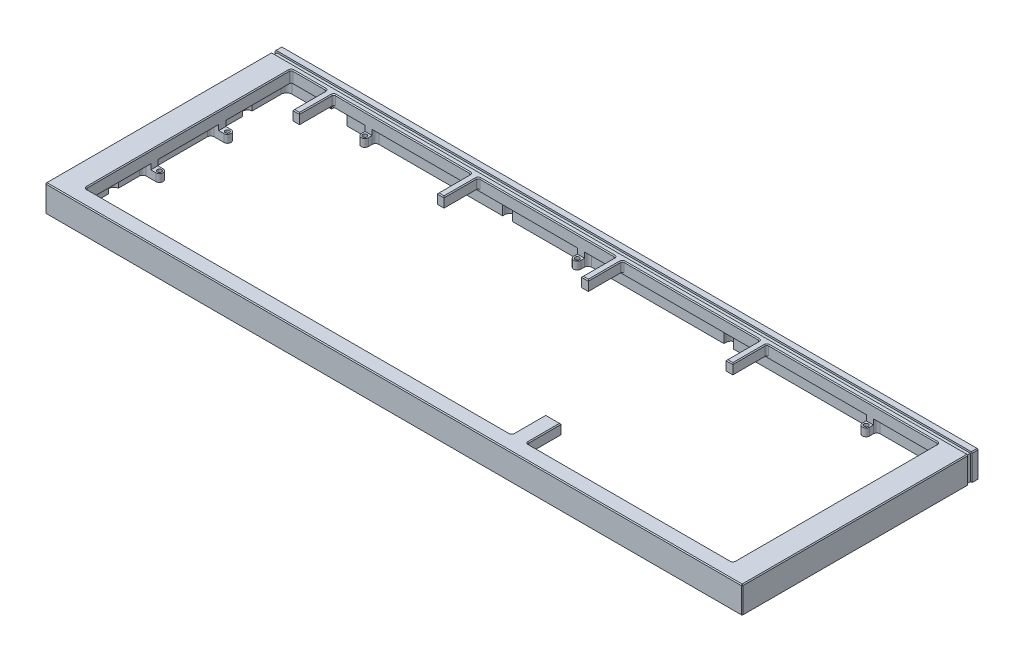
from build123d import *

# Parameters (mm, degrees)
SKETCH1_W                 = 390.74
SKETCH1_H                 = 132.7
SKETCH1_W_2               = 362.9
SKETCH1_H_2               = 115.3
MAIN_BODY_DEPTH           = 14.8
SKETCH2_W                 = 386.74
SKETCH2_H                 = 128.7
ALIGNMENT_GUIDE_DEPTH     = 1
SKETCH3_W                 = 8.7
SKETCH3_H                 = 19.1
SKETCH3_W_2               = 3.8
BLOCKERS_DEPTH            = 5.5
FILLET5_R                 = 1
SKETCH4_W                 = 371.8
SKETCH4_H                 = 119.1
PCB_CUTOUT_DEPTH          = 7.3
FILLET4_R                 = 3
PLATETABS_DEPTH           = 7.3
USB_CUTOUT_REACH          = 414.924
SKETCH9_W                 = 12
SKETCH9_H                 = 3.2
SKETCH11_W                = 15
SKETCH11_H                = 7.3
PCB_CLEARANCE_DEPTH       = 3.9
FILLET7_R                 = 2.5
CHAMFER1_SIZE             = 0.5
CHAMFER2_SIZE             = 0.1
SKETCH27_W                = 390.74
SKETCH27_H                = 2.5
CUT_EXTRUDE11_DEPTH       = 1
SKETCH28_W                = 1
SKETCH28_H                = 2.5
CUT_EXTRUDE12_DEPTH       = 413.889183196
M2X0_4_TAPPED_HOLE1_D     = 1.6
M2X0_4_TAPPED_HOLE1_DEPTH = 4
M2X0_4_TAPPED_HOLE1_TIP   = 0.480688495
FILLET8_R                 = 0.1
SKETCH32_R                = 2
SKETCH32_W                = 4
SKETCH32_H                = 4
SKETCH32_W_2              = 7.33
SKETCH32_H_2              = 4.8
BOSS_EXTRUDE1_DEPTH       = 4.3
SKETCH33_W                = 4.45
SKETCH33_H                = 4
SKETCH33_W_2              = 4
SKETCH33_H_2              = 1.9
BOSS_EXTRUDE2_DEPTH       = 3
FILLET9_R                 = 1.9
M2_CLEARANCE_HOLE1_D      = 2.4


with BuildPart() as part:
    # Sketch1 → Main Body (new body)
    with BuildSketch(Plane(origin=(0, 0, 0), x_dir=(1, 0, 0), z_dir=(0, 1, 0))):
        with Locations((195.37, 66.35)):
            Rectangle(SKETCH1_W, SKETCH1_H)
        with Locations((195.37, 66.35)):
            Rectangle(SKETCH1_W_2, SKETCH1_H_2, mode=Mode.SUBTRACT)
    extrude(amount=MAIN_BODY_DEPTH)

    # Sketch2 → Alignment Guide (cut)
    with BuildSketch(Plane.XZ):
        with Locations((195.37, -66.35)):
            Rectangle(SKETCH2_W, SKETCH2_H)
    extrude(amount=-ALIGNMENT_GUIDE_DEPTH, mode=Mode.SUBTRACT)

    # Sketch3 → Blockers (add)
    with BuildSketch(Plane(origin=(0, 14.8, 0), x_dir=(1, 0, 0), z_dir=(0, 1, 0))):
        with Locations((257.17, 18.25)):
            Rectangle(SKETCH3_W, SKETCH3_H)
        with Locations((35.82, 114.45)):
            Rectangle(SKETCH3_W_2, SKETCH3_H)
        with Locations((116.82, 114.45)):
            Rectangle(SKETCH3_W_2, SKETCH3_H)
        with Locations((197.72, 114.45)):
            Rectangle(SKETCH3_W_2, SKETCH3_H)
        with Locations((278.72, 114.45)):
            Rectangle(SKETCH3_W_2, SKETCH3_H)
    extrude(amount=-BLOCKERS_DEPTH)

    # Fillet5
    fillet5_edges = [part.edges().sort_by_distance(p)[0] for p in [
        (13.92, 7.9, -124),
        (13.92, 7.9, -8.7),
        (376.82, 7.9, -8.7),
        (376.82, 7.9, -124),
        (252.82, 12.05, -8.7),
        (261.52, 12.05, -8.7),
        (33.92, 12.05, -124),
        (37.72, 12.05, -124),
        (114.92, 12.05, -124),
        (118.72, 12.05, -124),
        (195.82, 12.05, -124),
        (199.62, 12.05, -124),
        (276.82, 12.05, -124),
        (280.62, 12.05, -124),
    ]]
    fillet(fillet5_edges, radius=FILLET5_R)

    # Sketch4 → PCB Cutout (cut)
    with BuildSketch(Plane.XZ.offset(-1)):
        with Locations((195.37, -66.35)):
            Rectangle(SKETCH4_W, SKETCH4_H)
    extrude(amount=-PCB_CUTOUT_DEPTH, mode=Mode.SUBTRACT)

    # Fillet4
    fillet4_edges = [part.edges().sort_by_distance(p)[0] for p in [
        (381.27, 4.65, -6.8),
        (381.27, 4.65, -125.9),
        (9.47, 4.65, -125.9),
        (9.47, 4.65, -6.8),
        (2, 0.5, -2),
        (388.74, 0.5, -2),
        (388.74, 0.5, -130.7),
        (2, 0.5, -130.7),
    ]]
    fillet(fillet4_edges, radius=FILLET4_R)

    # Sketch6 → PlateTabs (cut)
    with BuildSketch(Plane.XZ.offset(-1)):
        with BuildLine():
            ThreePointArc((381.27, -106.59271763), (383.084013406, -105.722498331), (383.82, -103.85))
            ThreePointArc((383.82, -103.85), (383.084013406, -101.977501669), (381.27, -101.10728237))
            Line((381.27, -101.10728237), (381.27, -106.59271763))
        make_face()
        with BuildLine():
            Line((381.27, -106.59271763), (381.27, -101.10728237))
            ThreePointArc((381.27, -101.10728237), (378.32, -103.85), (381.27, -106.59271763))
        make_face()
        with BuildLine():
            ThreePointArc((381.27, -26.10728237), (378.32, -28.85), (381.27, -31.59271763))
            Line((381.27, -31.59271763), (381.27, -26.10728237))
        make_face()
        with BuildLine():
            Line((381.27, -26.10728237), (381.27, -31.59271763))
            ThreePointArc((381.27, -31.59271763), (383.084013406, -30.722498331), (383.82, -28.85))
            ThreePointArc((383.82, -28.85), (383.084013406, -26.977501669), (381.27, -26.10728237))
        make_face()
        with BuildLine():
            Line((254.62, -6.8), (255.482541391, -6.8))
            ThreePointArc((255.482541391, -6.8), (254.844825632, -5.889033706), (254.62, -4.8))
            Line((254.62, -4.8), (254.62, -6.8))
        make_face()
        with BuildLine():
            Line((255.482541391, -6.8), (259.257458609, -6.8))
            ThreePointArc((259.257458609, -6.8), (259.895174368, -5.889033706), (260.12, -4.8))
            Line((260.12, -4.8), (254.62, -4.8))
            ThreePointArc((254.62, -4.8), (254.844825632, -5.889033706), (255.482541391, -6.8))
        make_face()
        with BuildLine():
            Line((259.257458609, -6.8), (260.12, -6.8))
            Line((260.12, -6.8), (260.12, -4.8))
            ThreePointArc((260.12, -4.8), (259.895174368, -5.889033706), (259.257458609, -6.8))
        make_face()
        with BuildLine():
            Line((254.62, -4.8), (260.12, -4.8))
            ThreePointArc((260.12, -4.8), (257.37, -2.05), (254.62, -4.8))
        make_face()
        with BuildLine():
            Line((260.12, -127.1), (254.62, -127.1))
            ThreePointArc((254.62, -127.1), (257.37, -129.85), (260.12, -127.1))
        make_face()
        with BuildLine():
            ThreePointArc((254.895631394, -125.9), (254.689793509, -126.484375791), (254.62, -127.1))
            Line((254.62, -127.1), (260.12, -127.1))
            ThreePointArc((260.12, -127.1), (260.050206491, -126.484375791), (259.844368606, -125.9))
            Line((259.844368606, -125.9), (254.895631394, -125.9))
        make_face()
        with BuildLine():
            Line((254.62, -125.9), (254.62, -127.1))
            ThreePointArc((254.62, -127.1), (254.689793509, -126.484375791), (254.895631394, -125.9))
            Line((254.895631394, -125.9), (254.62, -125.9))
        make_face()
        with BuildLine():
            ThreePointArc((130.62, -127.1), (133.37, -129.85), (136.12, -127.1))
            Line((136.12, -127.1), (130.62, -127.1))
        make_face()
        with BuildLine():
            ThreePointArc((136.12, -127.1), (136.050206491, -126.484375791), (135.844368606, -125.9))
            Line((135.844368606, -125.9), (130.895631394, -125.9))
            ThreePointArc((130.895631394, -125.9), (130.689793509, -126.484375791), (130.62, -127.1))
            Line((130.62, -127.1), (136.12, -127.1))
        make_face()
        with BuildLine():
            ThreePointArc((12.42, -103.85), (11.542498331, -101.835986594), (9.47, -101.10728237))
            Line((9.47, -101.10728237), (9.47, -106.59271763))
            ThreePointArc((9.47, -106.59271763), (11.542498331, -105.864013406), (12.42, -103.85))
        make_face()
        with BuildLine():
            Line((9.47, -106.59271763), (9.47, -101.10728237))
            ThreePointArc((9.47, -101.10728237), (6.92, -103.85), (9.47, -106.59271763))
        make_face()
        with BuildLine():
            ThreePointArc((9.47, -31.59271763), (11.542498331, -30.864013406), (12.42, -28.85))
            ThreePointArc((12.42, -28.85), (11.542498331, -26.835986594), (9.47, -26.10728237))
            Line((9.47, -26.10728237), (9.47, -31.59271763))
        make_face()
        with BuildLine():
            Line((9.47, -31.59271763), (9.47, -26.10728237))
            ThreePointArc((9.47, -26.10728237), (6.92, -28.85), (9.47, -31.59271763))
        make_face()
        with BuildLine():
            Line((130.62, -4.8), (136.12, -4.8))
            ThreePointArc((136.12, -4.8), (133.37, -2.05), (130.62, -4.8))
        make_face()
        with BuildLine():
            ThreePointArc((135.257458609, -6.8), (135.895174368, -5.889033706), (136.12, -4.8))
            Line((136.12, -4.8), (130.62, -4.8))
            ThreePointArc((130.62, -4.8), (130.844825632, -5.889033706), (131.482541391, -6.8))
            Line((131.482541391, -6.8), (135.257458609, -6.8))
        make_face()
        with BuildLine():
            ThreePointArc((259.844368606, -125.9), (260.050206491, -126.484375791), (260.12, -127.1))
            Line((260.12, -127.1), (260.12, -125.9))
            Line((260.12, -125.9), (259.844368606, -125.9))
        make_face()
        with BuildLine():
            ThreePointArc((131.482541391, -6.8), (130.844825632, -5.889033706), (130.62, -4.8))
            Line((130.62, -4.8), (130.62, -6.8))
            Line((130.62, -6.8), (131.482541391, -6.8))
        make_face()
        with BuildLine():
            Line((135.257458609, -6.8), (136.12, -6.8))
            Line((136.12, -6.8), (136.12, -4.8))
            ThreePointArc((136.12, -4.8), (135.895174368, -5.889033706), (135.257458609, -6.8))
        make_face()
        with BuildLine():
            Line((136.12, -127.1), (136.12, -125.9))
            Line((136.12, -125.9), (135.844368606, -125.9))
            ThreePointArc((135.844368606, -125.9), (136.050206491, -126.484375791), (136.12, -127.1))
        make_face()
        with BuildLine():
            ThreePointArc((130.62, -127.1), (130.689793509, -126.484375791), (130.895631394, -125.9))
            Line((130.895631394, -125.9), (130.62, -125.9))
            Line((130.62, -125.9), (130.62, -127.1))
        make_face()
    extrude(amount=-PLATETABS_DEPTH, mode=Mode.SUBTRACT)

    # USB Cutout: up to this face of the body (flat: up to its plane)
    usb_cutout_end = Plane(part.part.faces().sort_by_distance((195.37, 8.660958529, -124))[0])
    # Sketch9 → USB Cutout (cut, up to the picked face)
    with BuildSketch(Plane(origin=(0, 0, -132.7), x_dir=(-1, 0, 0), z_dir=(0, 0, -1)), mode=Mode.PRIVATE) as usb_cutout_sk1:
        with Locations((-35.8, 1.6)):
            Rectangle(SKETCH9_W, SKETCH9_H)
    usb_cutout_tool1 = split(extrude(usb_cutout_sk1.sketch, amount=-USB_CUTOUT_REACH, mode=Mode.PRIVATE), bisect_by=usb_cutout_end, keep=Keep.BOTH, mode=Mode.PRIVATE)
    add(usb_cutout_tool1.solids().sort_by(Axis((35.8, 1.6, -132.7), (0, 0, 1)))[0], mode=Mode.SUBTRACT)

    # Sketch11 → PCB Clearance (cut)
    with BuildSketch(Plane.XY.offset(-125.9)):
        with Locations((35.8, 4.65)):
            Rectangle(SKETCH11_W, SKETCH11_H)
    extrude(amount=-PCB_CLEARANCE_DEPTH, mode=Mode.SUBTRACT)

    # Fillet7
    fillet7_edges = [part.edges().sort_by_distance(p)[0] for p in [
        (28.3, 4.65, -129.8),
        (43.3, 4.65, -129.8),
    ]]
    fillet(fillet7_edges, radius=FILLET7_R)

    # Chamfer1
    chamfer1_edges = [part.edges().sort_by_distance(p)[0] for p in [
        (238.22, 14.8, -124),
        (157.27, 14.8, -124),
        (76.32, 14.8, -124),
        (23.92, 14.8, -124),
        (328.72, 14.8, -124),
        (276.82, 14.8, -113.95),
        (195.82, 14.8, -113.95),
        (114.92, 14.8, -113.95),
        (33.92, 14.8, -113.95),
        (390.74, 14.8, -66.35),
        (13.92, 14.8, -66.35),
        (319.17, 14.8, -8.7),
        (133.37, 14.8, -8.7),
        (261.52, 14.8, -18.75),
        (376.82, 14.8, -66.35),
        (280.912893219, 14.8, -123.707106781),
        (276.527106781, 14.8, -123.707106781),
        (195.527106781, 14.8, -123.707106781),
        (199.912893219, 14.8, -123.707106781),
        (119.012893219, 14.8, -123.707106781),
        (114.627106781, 14.8, -123.707106781),
        (33.627106781, 14.8, -123.707106781),
        (38.012893219, 14.8, -123.707106781),
        (14.212893219, 14.8, -123.707106781),
        (14.212893219, 14.8, -8.992893219),
        (252.527106781, 14.8, -8.992893219),
        (261.812893219, 14.8, -8.992893219),
        (376.527106781, 14.8, -8.992893219),
        (376.527106781, 14.8, -123.707106781),
        (195.37, 14.8, -132.7),
        (0, 14.8, -66.35),
        (252.82, 14.8, -18.75),
        (257.17, 14.8, -27.8),
        (35.82, 14.8, -104.9),
        (37.72, 14.8, -113.95),
        (116.82, 14.8, -104.9),
        (118.72, 14.8, -113.95),
        (0, 7.4, -132.7),
        (390.74, 7.4, -132.7),
        (390.74, 7.4, 0),
        (0, 7.4, 0),
        (197.72, 14.8, -104.9),
        (199.62, 14.8, -113.95),
        (195.37, 14.8, 0),
        (278.72, 14.8, -104.9),
        (280.62, 14.8, -113.95),
    ]]
    chamfer(chamfer1_edges, length=CHAMFER1_SIZE)

    # Chamfer2
    chamfer2_edges = [part.edges().sort_by_distance(p)[0] for p in [
        (15.15, 0, -132.7),
        (216.02, 0, -132.7),
        (390.74, 0, -66.35),
        (195.37, 0, 0),
        (0, 0, -66.35),
    ]]
    chamfer(chamfer2_edges, length=CHAMFER2_SIZE)

    # Sketch27 → Cut-Extrude11 (cut)
    with BuildSketch(Plane(origin=(0, 14.8, 0), x_dir=(1, 0, 0), z_dir=(0, 1, 0))):
        with Locations((195.37, 127.7)):
            Rectangle(SKETCH27_W, SKETCH27_H)
    extrude(amount=-CUT_EXTRUDE11_DEPTH, mode=Mode.SUBTRACT)

    # Sketch28 → Cut-Extrude12 (cut, through all)
    with BuildSketch(Plane(origin=(0, 13.8, 0), x_dir=(1, 0, 0), z_dir=(0, 1, 0))):
        with Locations((0.5, 127.7)):
            Rectangle(SKETCH28_W, SKETCH28_H)
        with Locations((390.24, 127.7)):
            Rectangle(SKETCH28_W, SKETCH28_H)
    extrude(amount=-CUT_EXTRUDE12_DEPTH, mode=Mode.SUBTRACT)

    # M2x0.4 Tapped Hole1
    with Locations(Plane(origin=(381.42, 8.3, -103.85), x_dir=(0, 0, -1), z_dir=(0, -1, 0))):
        with Locations((0, 0), (-75, 0), (-99, -124.05), (-99, -248.05), (-75, -372.1), (0, -372.1), (23.25, -248.05), (23.25, -124.05)):
            Hole(M2X0_4_TAPPED_HOLE1_D / 2, depth=M2X0_4_TAPPED_HOLE1_DEPTH)
            with Locations((0, 0, -(M2X0_4_TAPPED_HOLE1_DEPTH + M2X0_4_TAPPED_HOLE1_TIP / 2))):  # 118° drill point
                Cone(0, M2X0_4_TAPPED_HOLE1_D / 2, M2X0_4_TAPPED_HOLE1_TIP, mode=Mode.SUBTRACT)

    # Fillet8
    fillet8_edges = [part.edges().sort_by_distance(p)[0] for p in [
        (213.77, 0, -130.7),
        (2, 0, -66.35),
        (195.37, 0, -2),
        (388.74, 0, -66.35),
        (2.878679656, 0, -129.821320344),
        (2.878679656, 0, -2.878679656),
        (387.861320344, 0, -2.878679656),
        (387.861320344, 0, -129.821320344),
        (17.4, 0, -130.7),
    ]]
    fillet(fillet8_edges, radius=FILLET8_R)

    # Sketch32 → Boss-Extrude1 (add)
    with BuildSketch(Plane.XZ.offset(-1)):
        with Locations((338.3, -121.9)):
            Circle(SKETCH32_R)
        with Locations((176.4, -121.9)):
            Circle(SKETCH32_R)
        with Locations((57.3, -121.9)):
            Circle(SKETCH32_R)
        with Locations((16.8, -85.4)):
            Circle(SKETCH32_R)
        with Locations((16.8, -47.3)):
            Circle(SKETCH32_R)
        with Locations((85.9, -11.6)):
            Circle(SKETCH32_R)
        with Locations((156.5, -11.6)):
            Circle(SKETCH32_R)
        with Locations((300.2, -11.6)):
            Circle(SKETCH32_R)
        with Locations((373.94, -47.3)):
            Circle(SKETCH32_R)
        with Locations((373.94, -85.4)):
            Circle(SKETCH32_R)
        with Locations((338.3, -123.9)):
            Rectangle(SKETCH32_W, SKETCH32_H)
        with Locations((176.4, -123.9)):
            Rectangle(SKETCH32_W, SKETCH32_H)
        with Locations((57.3, -123.9)):
            Rectangle(SKETCH32_W, SKETCH32_H)
        with Locations((13.135, -85.4)):
            Rectangle(SKETCH32_W_2, SKETCH32_H)
        with Locations((13.135, -47.3)):
            Rectangle(SKETCH32_W_2, SKETCH32_H)
        with Locations((85.9, -9.2)):
            Rectangle(SKETCH32_W, SKETCH32_H_2)
        with Locations((156.5, -9.2)):
            Rectangle(SKETCH32_W, SKETCH32_H_2)
        with Locations((300.2, -9.2)):
            Rectangle(SKETCH32_W, SKETCH32_H_2)
        with Locations((377.605, -47.3)):
            Rectangle(SKETCH32_W_2, SKETCH32_H)
        with Locations((377.605, -85.4)):
            Rectangle(SKETCH32_W_2, SKETCH32_H)
    extrude(amount=-BOSS_EXTRUDE1_DEPTH)

    # Sketch33 → Boss-Extrude2 (add)
    with BuildSketch(Plane.XZ.offset(-8.3)):
        with Locations((379.045, -85.4)):
            Rectangle(SKETCH33_W, SKETCH33_H)
        with Locations((379.045, -47.3)):
            Rectangle(SKETCH33_W, SKETCH33_H)
        with Locations((300.2, -7.75)):
            Rectangle(SKETCH33_W_2, SKETCH33_H_2)
        with Locations((156.5, -7.75)):
            Rectangle(SKETCH33_W_2, SKETCH33_H_2)
        with Locations((85.9, -7.75)):
            Rectangle(SKETCH33_W_2, SKETCH33_H_2)
        with Locations((11.695, -47.3)):
            Rectangle(SKETCH33_W, SKETCH33_H)
        with Locations((11.695, -85.4)):
            Rectangle(SKETCH33_W, SKETCH33_H)
        with Locations((57.3, -124.95)):
            Rectangle(SKETCH33_W_2, SKETCH33_H_2)
        with Locations((176.4, -124.95)):
            Rectangle(SKETCH33_W_2, SKETCH33_H_2)
        with Locations((338.3, -124.95)):
            Rectangle(SKETCH33_W_2, SKETCH33_H_2)
    extrude(amount=BOSS_EXTRUDE2_DEPTH)

    # Fillet9
    fillet9_edges = [part.edges().sort_by_distance(p)[0] for p in [
        (340.3, 4.65, -125.9),
        (336.3, 4.65, -125.9),
        (174.4, 4.65, -125.9),
        (178.4, 4.65, -125.9),
        (59.3, 4.65, -125.9),
        (55.3, 4.65, -125.9),
        (9.47, 4.65, -87.4),
        (9.47, 4.65, -83.4),
        (9.47, 4.65, -45.3),
        (9.47, 4.65, -49.3),
        (87.9, 4.65, -6.8),
        (83.9, 4.65, -6.8),
        (154.5, 4.65, -6.8),
        (158.5, 4.65, -6.8),
        (302.2, 4.65, -6.8),
        (298.2, 4.65, -6.8),
        (381.27, 4.65, -45.3),
        (381.27, 4.65, -49.3),
        (381.27, 4.65, -87.4),
    ]]
    fillet(fillet9_edges, radius=FILLET9_R - 0.0001)  # a hair under: the kernel refuses the full size

    # M2 Clearance Hole1 (through all)
    with Locations(Plane(origin=(57.3, 5.3, -121.9), x_dir=(0, 0, 1), z_dir=(0, 1, 0))):
        with Locations((0, 0), (36.5, -40.5), (74.6, -40.5), (110.3, 28.6), (110.3, 99.2), (110.3, 242.9), (74.6, 316.64), (36.5, 316.64), (0, 281), (0, 119.1)):
            Hole(M2_CLEARANCE_HOLE1_D / 2)


solid = part.part
